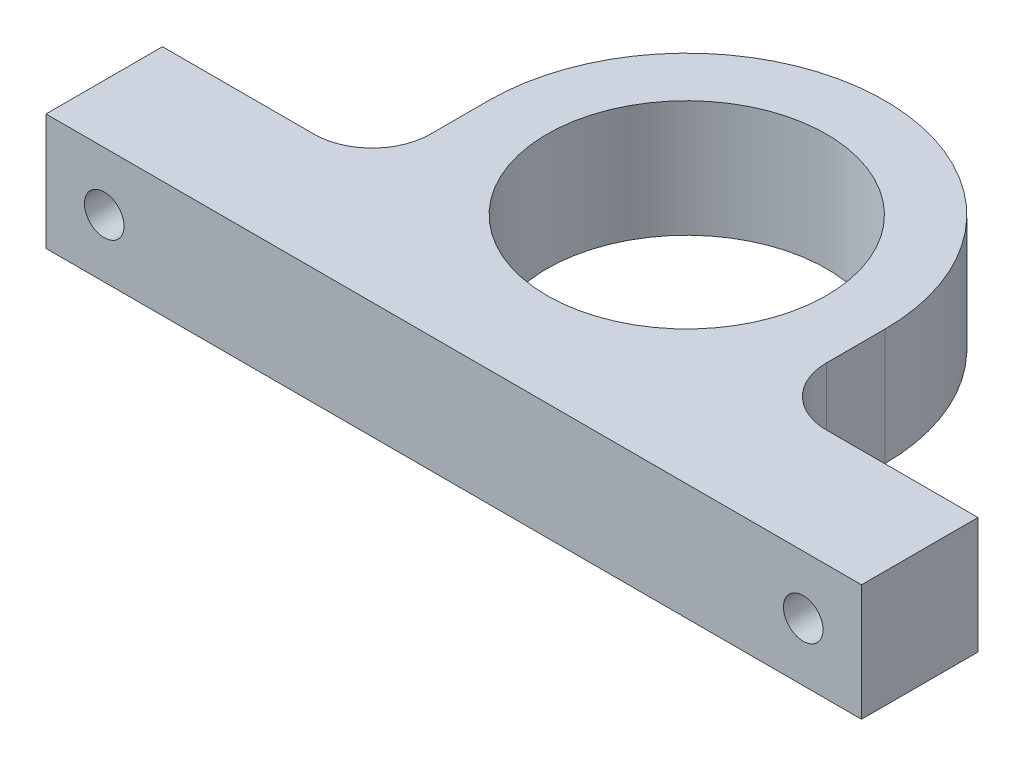
from build123d import *

# Parameters (mm, degrees)
SKETCH1_R                                       = 12
BOSS_EXTRUDE1_DEPTH                             = 10
FILLET1_R                                       = 5
CSK_FOR_M3_FLAT_HEAD_MACHINE_SCREW1_D           = 3.4
CSK_FOR_M3_FLAT_HEAD_MACHINE_SCREW1_CSINK_D     = 6.3
CSK_FOR_M3_FLAT_HEAD_MACHINE_SCREW1_CSINK_ANGLE = 90


with BuildPart() as part:
    # Sketch1 → Boss-Extrude1 (new body)
    with BuildSketch(Plane(origin=(0, 0, 0), x_dir=(1, 0, 0), z_dir=(0, 1, 0))):
        with BuildLine():
            Line((35, 0), (-35, 0))
            Line((-35, 0), (-35, 10))
            Line((-35, 10), (-17, 10))
            Line((-17, 10), (-17, 20))
            ThreePointArc((-17, 20), (0, 37), (17, 20))
            Line((17, 20), (17, 10))
            Line((17, 10), (35, 10))
            Line((35, 10), (35, 0))
        make_face()
        with Locations((0, 20)):
            Circle(SKETCH1_R, mode=Mode.SUBTRACT)
    extrude(amount=BOSS_EXTRUDE1_DEPTH)

    # Fillet1
    fillet1_edges = [part.edges().sort_by_distance(p)[0] for p in [
        (-17, 5, -10),
        (17, 5, -10),
    ]]
    fillet(fillet1_edges, radius=FILLET1_R)

    # CSK for M3 Flat Head Machine Screw1 (through all)
    with Locations(Plane(origin=(30, 5, -10), x_dir=(-1, 0, 0), z_dir=(0, 0, -1))):
        with Locations((0, 0), (60, 0)):
            CounterSinkHole(CSK_FOR_M3_FLAT_HEAD_MACHINE_SCREW1_D / 2, CSK_FOR_M3_FLAT_HEAD_MACHINE_SCREW1_CSINK_D / 2, counter_sink_angle=CSK_FOR_M3_FLAT_HEAD_MACHINE_SCREW1_CSINK_ANGLE)


solid = part.part
